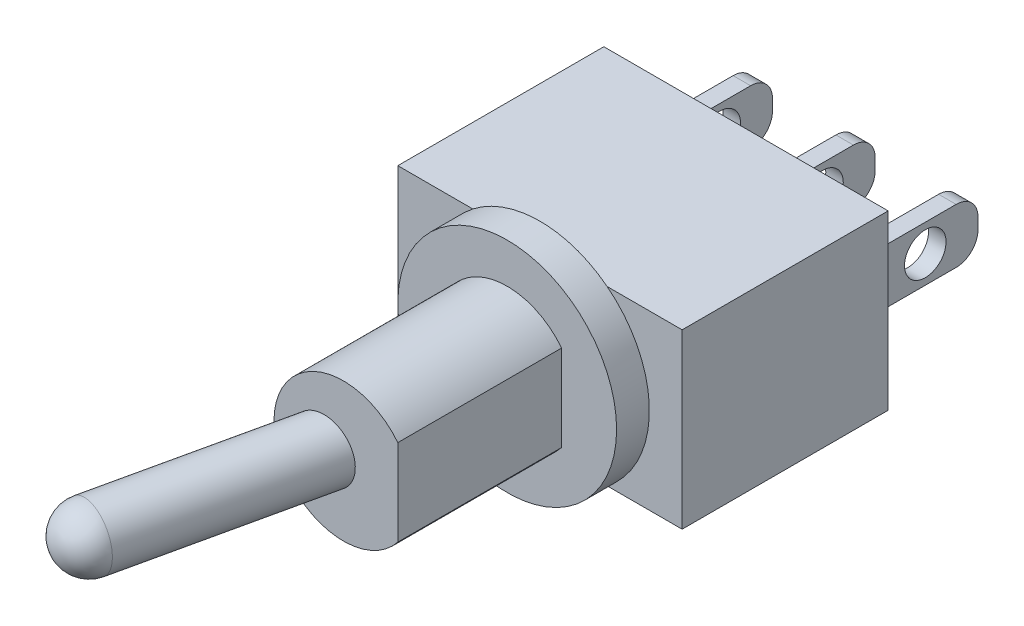
from build123d import *

# Parameters (mm, degrees)
SKETCH2_W           = 13.0048
SKETCH2_H           = 7.8994
BOSS_EXTRUDE1_DEPTH = 9.4234
BOSS_EXTRUDE2_START = 4.7
SKETCH5_R           = 0.95
BOSS_EXTRUDE2_DEPTH = 0.4
LPATTERN1_COUNT     = 3
LPATTERN1_PITCH     = 4.7
SKETCH6_R           = 5.0038
BOSS_EXTRUDE3_DEPTH = 1.4986
BOSS_EXTRUDE5_DEPTH = 7.493


with BuildPart() as part:
    # Sketch2 → Boss-Extrude1 (new body)
    with BuildSketch(Plane.XY):
        Rectangle(SKETCH2_W, SKETCH2_H)
    extrude(amount=-BOSS_EXTRUDE1_DEPTH)

    # Sketch5 → Boss-Extrude2 (add, symmetric)
    with BuildSketch(Plane(origin=(0, 0, 0), x_dir=(0, 0, -1), z_dir=(1, 0, 0)).offset(BOSS_EXTRUDE2_START)):
        with BuildLine():
            Line((9.4234, 1.25), (9.4234, -1.25))
            Line((9.4234, -1.25), (13.9352, -1.25))
            ThreePointArc((13.9352, -1.25), (14.642306781, -0.957106781), (14.9352, -0.25))
            Line((14.9352, -0.25), (14.9352, 0.25))
            ThreePointArc((14.9352, 0.25), (14.642306781, 0.957106781), (13.9352, 1.25))
            Line((13.9352, 1.25), (9.4234, 1.25))
        make_face()
        with Locations((12.5234, 0)):
            Circle(SKETCH5_R, mode=Mode.SUBTRACT)
    boss_extrude2 = extrude(amount=BOSS_EXTRUDE2_DEPTH, both=True)

    # LPattern1: Boss-Extrude2 ×3
    with Locations(*[(-i * LPATTERN1_PITCH, 0, 0) for i in range(1, LPATTERN1_COUNT)]):
        add(boss_extrude2)

    # Sketch6 → Boss-Extrude3 (add)
    with BuildSketch(Plane.XY):
        Circle(SKETCH6_R)
    extrude(amount=BOSS_EXTRUDE3_DEPTH)

    # Sketch7 → Boss-Extrude5 (add)
    with BuildSketch(Plane.XY.offset(1.4986)):
        with BuildLine():
            Line((2.4892, -1.970915615), (2.4892, 1.970915615))
            ThreePointArc((2.4892, 1.970915615), (-3.175, 0), (2.4892, -1.970915615))
        make_face()
    extrude(amount=BOSS_EXTRUDE5_DEPTH)

    # Sketch8 → Revolve1 (revolve)
    with BuildSketch(Plane(origin=(0, 0, 0), x_dir=(1, 0, 0), z_dir=(0, 1, 0))):
        with BuildLine():
            Line((-3.138374402, -19.147892103), (0, -4.9916))
            Line((0, -4.9916), (-1.363885522, -4.689233859))
            Line((-1.363885522, -4.689233859), (-4.199893783, -17.481640441))
            ThreePointArc((-4.199893783, -17.481640441), (-4.014226111, -18.534614134), (-3.138374402, -19.147892103))
        make_face()
    revolve(axis=Axis((-3.138374402, 0, 19.147892103), (0.21643961393810326, 0, -0.9762960071199334)))


solid = part.part
